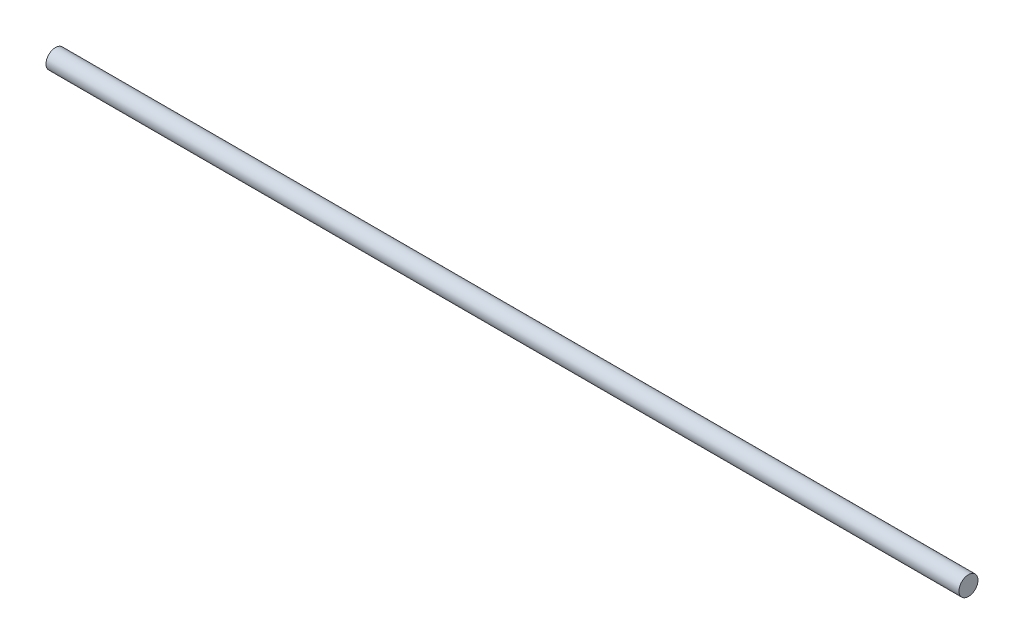
from build123d import *

# Parameters (mm, degrees)
SKETCH1_R           = 1.50495
BOSS_EXTRUDE1_DEPTH = 72.3011


with BuildPart() as part:
    # Sketch1 → Boss-Extrude1 (new, symmetric)
    with BuildSketch(Plane(origin=(0, 0, 0), x_dir=(0, 0, -1), z_dir=(1, 0, 0))):
        Circle(SKETCH1_R)
    extrude(amount=BOSS_EXTRUDE1_DEPTH, both=True)


solid = part.part
